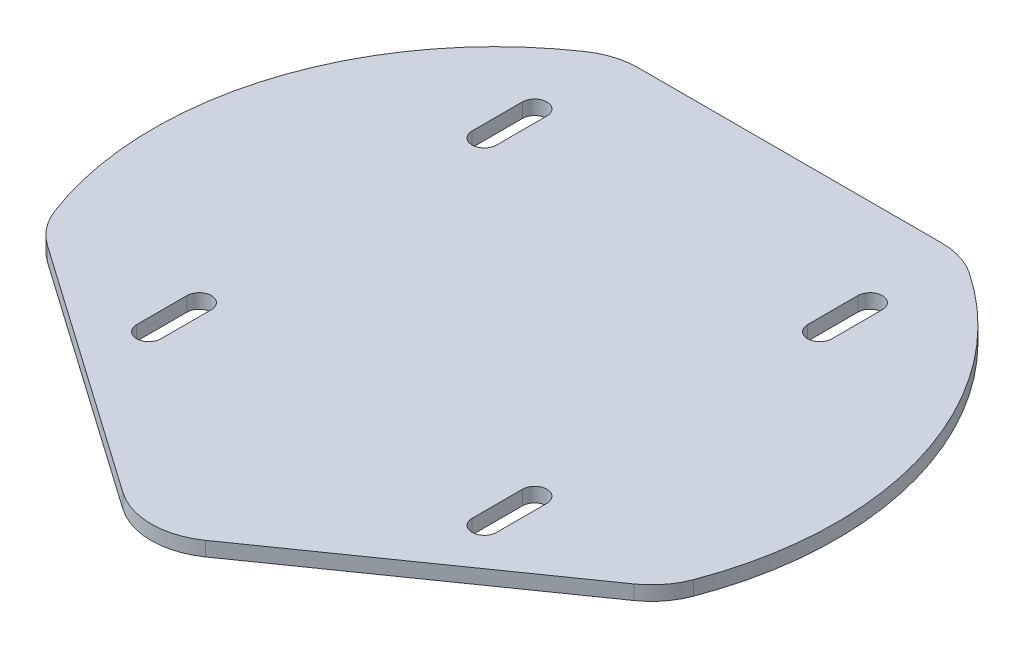
from build123d import *

# Parameters (mm, degrees)
BOSS_EXTRUDE1_DEPTH     = 2
ENL_V_MAT_EXTRU_1_REACH = 71.032
CONG_1_R                = 10


with BuildPart() as part:
    # Sketch1 → Boss-Extrude1 (new body)
    with BuildSketch(Plane(origin=(0, 0, 0), x_dir=(1, 0, 0), z_dir=(0, 1, 0))):
        with BuildLine():
            ThreePointArc((-23.98436991, 41), (-45.301555161, 14.283525476), (-43.163479533, -19.828364395))
            Line((-43.163479533, -19.828364395), (0, -50.051758139))
            Line((0, -50.051758139), (43.163479533, -19.828364395))
            ThreePointArc((43.163479533, -19.828364395), (45.301555161, 14.283525476), (23.98436991, 41))
            Line((23.98436991, 41), (-23.98436991, 41))
        make_face()
    extrude(amount=BOSS_EXTRUDE1_DEPTH)

    # Esquisse1 → Enlèv. mat.-Extru.1 (cut, up to next)
    with BuildSketch(Plane(origin=(0, 2, 0), x_dir=(1, 0, 0), z_dir=(0, 1, 0)), mode=Mode.PRIVATE) as enl_v_mat_extru_1_sk1:
        with BuildLine():
            Line((-21.634523779, 28.834523779), (-21.634523779, 21.834523779))
            ThreePointArc((-21.634523779, 21.834523779), (-23.334523779, 20.134523779), (-25.034523779, 21.834523779))
            Line((-25.034523779, 21.834523779), (-25.034523779, 28.834523779))
            ThreePointArc((-25.034523779, 28.834523779), (-23.334523779, 30.534523779), (-21.634523779, 28.834523779))
        make_face()
    enl_v_mat_extru_1_tool1 = extrude(enl_v_mat_extru_1_sk1.sketch, amount=-ENL_V_MAT_EXTRU_1_REACH, mode=Mode.PRIVATE) & part.part
    # Esquisse1 → Enlèv. mat.-Extru.1 (cut, up to next)
    with BuildSketch(Plane(origin=(0, 2, 0), x_dir=(1, 0, 0), z_dir=(0, 1, 0)), mode=Mode.PRIVATE) as enl_v_mat_extru_1_sk2:
        with BuildLine():
            Line((21.634523779, 21.834523779), (21.634523779, 28.834523779))
            ThreePointArc((21.634523779, 28.834523779), (23.334523779, 30.534523779), (25.034523779, 28.834523779))
            Line((25.034523779, 28.834523779), (25.034523779, 21.834523779))
            ThreePointArc((25.034523779, 21.834523779), (23.334523779, 20.134523779), (21.634523779, 21.834523779))
        make_face()
    enl_v_mat_extru_1_tool2 = extrude(enl_v_mat_extru_1_sk2.sketch, amount=-ENL_V_MAT_EXTRU_1_REACH, mode=Mode.PRIVATE) & part.part
    # Esquisse1 → Enlèv. mat.-Extru.1 (cut, up to next)
    with BuildSketch(Plane(origin=(0, 2, 0), x_dir=(1, 0, 0), z_dir=(0, 1, 0)), mode=Mode.PRIVATE) as enl_v_mat_extru_1_sk3:
        with BuildLine():
            Line((21.634523779, -24.834523779), (21.634523779, -17.834523779))
            ThreePointArc((21.634523779, -17.834523779), (23.334523779, -16.134523779), (25.034523779, -17.834523779))
            Line((25.034523779, -17.834523779), (25.034523779, -24.834523779))
            ThreePointArc((25.034523779, -24.834523779), (23.334523779, -26.534523779), (21.634523779, -24.834523779))
        make_face()
    enl_v_mat_extru_1_tool3 = extrude(enl_v_mat_extru_1_sk3.sketch, amount=-ENL_V_MAT_EXTRU_1_REACH, mode=Mode.PRIVATE) & part.part
    # Esquisse1 → Enlèv. mat.-Extru.1 (cut, up to next)
    with BuildSketch(Plane(origin=(0, 2, 0), x_dir=(1, 0, 0), z_dir=(0, 1, 0)), mode=Mode.PRIVATE) as enl_v_mat_extru_1_sk4:
        with BuildLine():
            Line((-25.034523779, -24.834523779), (-25.034523779, -17.834523779))
            ThreePointArc((-25.034523779, -17.834523779), (-23.334523779, -16.134523779), (-21.634523779, -17.834523779))
            Line((-21.634523779, -17.834523779), (-21.634523779, -24.834523779))
            ThreePointArc((-21.634523779, -24.834523779), (-23.334523779, -26.534523779), (-25.034523779, -24.834523779))
        make_face()
    enl_v_mat_extru_1_tool4 = extrude(enl_v_mat_extru_1_sk4.sketch, amount=-ENL_V_MAT_EXTRU_1_REACH, mode=Mode.PRIVATE) & part.part
    add(enl_v_mat_extru_1_tool1.solids().sort_by_distance((-23.334524, 2, -25.334524))[0], mode=Mode.SUBTRACT)
    add(enl_v_mat_extru_1_tool2.solids().sort_by_distance((23.334524, 2, -25.334524))[0], mode=Mode.SUBTRACT)
    add(enl_v_mat_extru_1_tool3.solids().sort_by_distance((23.334524, 2, 21.334524))[0], mode=Mode.SUBTRACT)
    add(enl_v_mat_extru_1_tool4.solids().sort_by_distance((-23.334524, 2, 21.334524))[0], mode=Mode.SUBTRACT)

    # Congé1
    cong_1_edges = [part.edges().sort_by_distance(p)[0] for p in [
        (43.163479533, 1, 19.828364395),
        (23.98436991, 1, -41),
        (-23.98436991, 1, -41),
        (-43.163479533, 1, 19.828364395),
        (0, 1, 50.051758139),
    ]]
    fillet(cong_1_edges, radius=CONG_1_R)


solid = part.part
